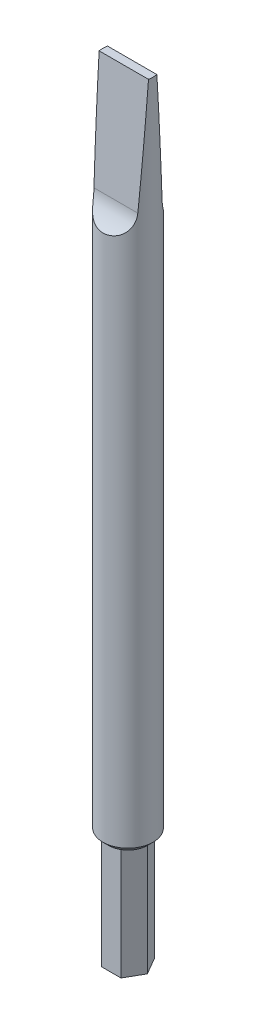
from build123d import *

# Parameters (mm, degrees)
BOSS_EXTRUDE1_DEPTH = 20
SKETCH3_R           = 4.5
BOSS_EXTRUDE3_DEPTH = 120
CHAMFER2_SIZE       = 1
CUT_EXTRUDE2_START  = -4.437059837
CUT_EXTRUDE2_DEPTH  = 8.874119674
FILLET2_R           = 5


# Read off the part's stored shape, not the designer's step: Cut-Extrude2
with BuildPart() as part:
    # Sketch2 → Boss-Extrude1 (new body)
    with BuildSketch(Plane(origin=(0, 0, 0), x_dir=(1, 0, 0), z_dir=(0, 1, 0))):
        Polygon((3.464101615, 0), (1.732050808, 3), (-1.732050808, 3), (-3.464101615, 0), (-1.732050808, -3), (1.732050808, -3), align=None)
    extrude(amount=BOSS_EXTRUDE1_DEPTH)


with BuildPart() as body_2:
    # Sketch3 → Boss-Extrude3 (new body)
    with BuildSketch(Plane(origin=(0, 20, 0), x_dir=(1, 0, 0), z_dir=(0, 1, 0))):
        with Locations(Location((0, 0, 0), (0, 0, 270))):
            Circle(SKETCH3_R)
    extrude(amount=BOSS_EXTRUDE3_DEPTH)

    # Chamfer2
    chamfer2_edges = [body_2.edges().sort_by_distance(p)[0] for p in [
        (0, 20, -4.5),
    ]]
    chamfer(chamfer2_edges, length=CHAMFER2_SIZE)

    # Cut-Extrude2 outline → Cut-Extrude2 (cut)
    with BuildSketch(Plane.YZ.offset(CUT_EXTRUDE2_START)):
        Polygon((115, 6), (115, 2.498170299), (140, 0.75), (140, 6), align=None)
        Polygon((140, -6), (140, -0.75), (115, -2.498170299), (115, -6), align=None)
    extrude(amount=CUT_EXTRUDE2_DEPTH, mode=Mode.SUBTRACT)

    # Fillet2
    # the kernel refuses this fillet: 5 mm, written as the material it adds along each edge
    with BuildSketch(Plane(origin=(-15.399317837, 115, -2.498170299), x_dir=(0, 0.9975640502586796, 0.0697564737604944), z_dir=(1, 0, 0))) as fillet2_piece_1_section:
        with BuildLine():
            CenterArc((FILLET2_R * 0.932515086122, -FILLET2_R), FILLET2_R, 90, 85.999999999)
            Line((-FILLET2_R * 0.0650489641364, -FILLET2_R * 0.93024352624), (0, 0))
            Line((0, 0), (FILLET2_R * 0.932515086122, 0))
        make_face()
    fillet2_piece_1 = extrude(amount=30.798635674, mode=Mode.PRIVATE)
    fillet2_piece_1 = fillet2_piece_1 & Plane(origin=(0, 116.359542547, 0), x_dir=(0, 0, 1), z_dir=(0, -1, 0)) * Cylinder(4.5, 81, mode=Mode.PRIVATE)
    add(fillet2_piece_1)
    with BuildSketch(Plane(origin=(-15.399317837, 115, 2.498170299), x_dir=(0, 0, 1), z_dir=(1, 0, 0))) as fillet2_piece_2_section:
        with BuildLine():
            CenterArc((FILLET2_R * 0.932515086122, -FILLET2_R), FILLET2_R, 90, 85.999999999)
            Line((-FILLET2_R * 0.0650489641364, -FILLET2_R * 0.93024352624), (0, 0))
            Line((0, 0), (FILLET2_R * 0.932515086122, 0))
        make_face()
    fillet2_piece_2 = extrude(amount=30.798635674, mode=Mode.PRIVATE)
    fillet2_piece_2 = fillet2_piece_2 & Plane(origin=(0, 116.359541243, 0), x_dir=(0, 0, 1), z_dir=(0, -1, 0)) * Cylinder(4.5, 81, mode=Mode.PRIVATE)
    add(fillet2_piece_2)


solid = Compound([part.part, body_2.part])
